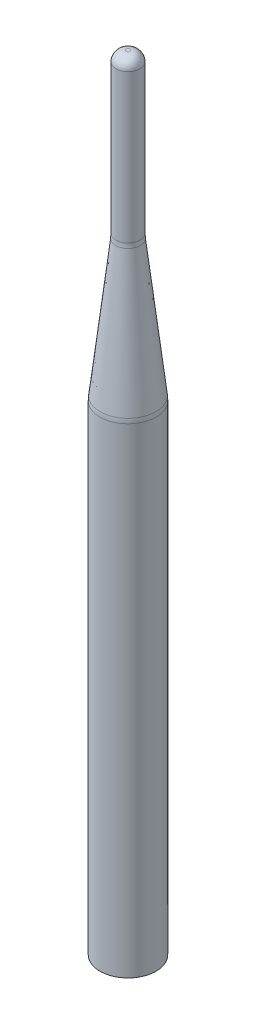
from build123d import *


with BuildPart() as part:
    # Sketch2 → Antenna (revolve)
    with BuildSketch(Plane.XY):
        with BuildLine():
            Line((3, 192.5), (3, 155.569574769))
            ThreePointArc((3, 155.569574769), (3.01618141, 155.000921652), (3.064673273, 154.434108857))
            Line((3.064673273, 154.434108857), (6.935326727, 120.565891143))
            ThreePointArc((6.935326727, 120.565891143), (6.98381859, 119.999078348), (7, 119.430425231))
            Line((7, 119.430425231), (7, 0))
            Line((7, 0), (0, 0))
            Line((0, 0), (0, 195))
            Line((0, 195), (0.5, 195))
            ThreePointArc((0.5, 195), (2.267766953, 194.267766953), (3, 192.5))
        make_face()
    revolve(axis=Axis((0, 0, 0), (0, 1, 0)))


solid = part.part
